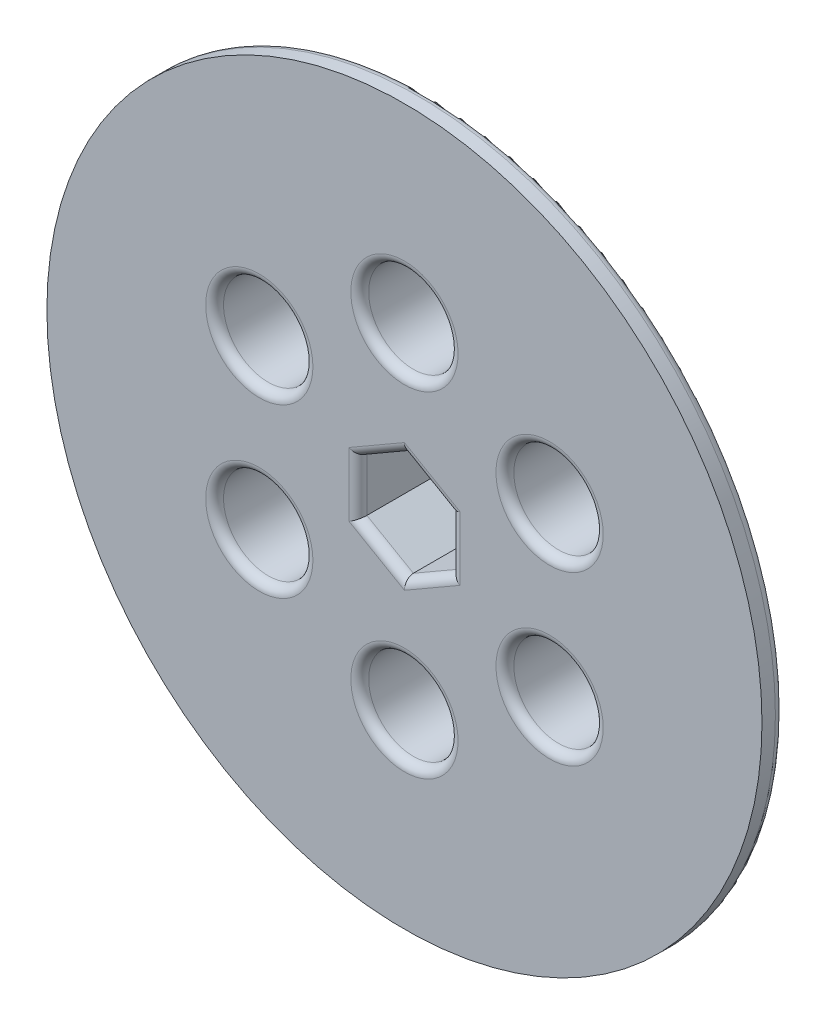
from build123d import *

# Parameters (mm, degrees)
SKETCH1_R           = 31.75
BOSS_EXTRUDE1_DEPTH = 12.7
SKETCH2_R           = 50.8
BOSS_EXTRUDE2_DEPTH = 3.175
CUT_EXTRUDE_R_REACH = 75.575
SKETCH3_R           = 2.667
SKETCH4_R           = 6.35
CUT_EXTRUDE2_DEPTH  = 10.16
FILLET1_R           = 1.27


with BuildPart() as part:
    # Sketch1 → Boss-Extrude1 (new body)
    with BuildSketch(Plane.XY):
        Circle(SKETCH1_R)
    extrude(amount=BOSS_EXTRUDE1_DEPTH)

    # Sketch2 → Boss-Extrude2 (add)
    with BuildSketch(Plane.XY.offset(12.7)):
        Circle(SKETCH2_R)
    extrude(amount=BOSS_EXTRUDE2_DEPTH)

    # Sketch3 → Cut-Extrude r (cut, up to next)
    with BuildSketch(Plane(origin=(0, 0, 0), x_dir=(-1, 0, 0), z_dir=(0, 0, -1)), mode=Mode.PRIVATE) as cut_extrude_r_sk1:
        with Locations((0, 23.8125)):
            Circle(SKETCH3_R)
    cut_extrude_r_tool1 = extrude(cut_extrude_r_sk1.sketch, amount=-CUT_EXTRUDE_R_REACH, mode=Mode.PRIVATE) & part.part
    # Sketch3 → Cut-Extrude r (cut, up to next)
    with BuildSketch(Plane(origin=(0, 0, 0), x_dir=(-1, 0, 0), z_dir=(0, 0, -1)), mode=Mode.PRIVATE) as cut_extrude_r_sk2:
        with Locations((20.622229928, 11.90625)):
            Circle(SKETCH3_R)
    cut_extrude_r_tool2 = extrude(cut_extrude_r_sk2.sketch, amount=-CUT_EXTRUDE_R_REACH, mode=Mode.PRIVATE) & part.part
    # Sketch3 → Cut-Extrude r (cut, up to next)
    with BuildSketch(Plane(origin=(0, 0, 0), x_dir=(-1, 0, 0), z_dir=(0, 0, -1)), mode=Mode.PRIVATE) as cut_extrude_r_sk3:
        with Locations((20.622229928, -11.90625)):
            Circle(SKETCH3_R)
    cut_extrude_r_tool3 = extrude(cut_extrude_r_sk3.sketch, amount=-CUT_EXTRUDE_R_REACH, mode=Mode.PRIVATE) & part.part
    # Sketch3 → Cut-Extrude r (cut, up to next)
    with BuildSketch(Plane(origin=(0, 0, 0), x_dir=(-1, 0, 0), z_dir=(0, 0, -1)), mode=Mode.PRIVATE) as cut_extrude_r_sk4:
        with Locations((0, -23.8125)):
            Circle(SKETCH3_R)
    cut_extrude_r_tool4 = extrude(cut_extrude_r_sk4.sketch, amount=-CUT_EXTRUDE_R_REACH, mode=Mode.PRIVATE) & part.part
    # Sketch3 → Cut-Extrude r (cut, up to next)
    with BuildSketch(Plane(origin=(0, 0, 0), x_dir=(-1, 0, 0), z_dir=(0, 0, -1)), mode=Mode.PRIVATE) as cut_extrude_r_sk5:
        with Locations((-20.622229928, -11.90625)):
            Circle(SKETCH3_R)
    cut_extrude_r_tool5 = extrude(cut_extrude_r_sk5.sketch, amount=-CUT_EXTRUDE_R_REACH, mode=Mode.PRIVATE) & part.part
    # Sketch3 → Cut-Extrude r (cut, up to next)
    with BuildSketch(Plane(origin=(0, 0, 0), x_dir=(-1, 0, 0), z_dir=(0, 0, -1)), mode=Mode.PRIVATE) as cut_extrude_r_sk6:
        with Locations((-20.622229928, 11.90625)):
            Circle(SKETCH3_R)
    cut_extrude_r_tool6 = extrude(cut_extrude_r_sk6.sketch, amount=-CUT_EXTRUDE_R_REACH, mode=Mode.PRIVATE) & part.part
    # Sketch3 → Cut-Extrude r (cut, up to next)
    with BuildSketch(Plane(origin=(0, 0, 0), x_dir=(-1, 0, 0), z_dir=(0, 0, -1)), mode=Mode.PRIVATE) as cut_extrude_r_sk7:
        Polygon((0, 7.625642355), (-6.604, 3.812821178), (-6.604, -3.812821178), (0, -7.625642355), (6.604, -3.812821178), (6.604, 3.812821178), align=None)
    cut_extrude_r_tool7 = extrude(cut_extrude_r_sk7.sketch, amount=-CUT_EXTRUDE_R_REACH, mode=Mode.PRIVATE) & part.part
    add(cut_extrude_r_tool1.solids().sort_by_distance((0, 23.8125, 0))[0], mode=Mode.SUBTRACT)
    add(cut_extrude_r_tool2.solids().sort_by_distance((-20.62223, 11.90625, 0))[0], mode=Mode.SUBTRACT)
    add(cut_extrude_r_tool3.solids().sort_by_distance((-20.62223, -11.90625, 0))[0], mode=Mode.SUBTRACT)
    add(cut_extrude_r_tool4.solids().sort_by_distance((0, -23.8125, 0))[0], mode=Mode.SUBTRACT)
    add(cut_extrude_r_tool5.solids().sort_by_distance((20.62223, -11.90625, 0))[0], mode=Mode.SUBTRACT)
    add(cut_extrude_r_tool6.solids().sort_by_distance((20.62223, 11.90625, 0))[0], mode=Mode.SUBTRACT)
    add(cut_extrude_r_tool7.solids().sort_by_distance((0, 0, 0))[0], mode=Mode.SUBTRACT)

    # Sketch4 → Cut-Extrude2 (cut)
    with BuildSketch(Plane.XY.offset(15.875)):
        with Locations((-20.622229928, -11.90625)):
            Circle(SKETCH4_R)
        with Locations((-20.622229928, 11.90625)):
            Circle(SKETCH4_R)
        with Locations((0, 23.8125)):
            Circle(SKETCH4_R)
        with Locations((20.622229928, 11.90625)):
            Circle(SKETCH4_R)
        with Locations((20.622229928, -11.90625)):
            Circle(SKETCH4_R)
        with Locations((0, -23.8125)):
            Circle(SKETCH4_R)
    extrude(amount=-CUT_EXTRUDE2_DEPTH, mode=Mode.SUBTRACT)

    # Fillet1
    fillet1_edges = [part.edges().sort_by_distance(p)[0] for p in [
        (-50.8, 0, 12.7),
        (-26.972229928, 11.90625, 15.875),
        (-6.35, 23.8125, 15.875),
        (14.272229928, 11.90625, 15.875),
        (14.272229928, -11.90625, 15.875),
        (-26.972229928, -11.90625, 15.875),
        (-6.35, -23.8125, 15.875),
        (6.604, 0, 15.875),
        (3.302, 5.719231767, 15.875),
        (-3.302, 5.719231767, 15.875),
        (-6.604, 0, 15.875),
        (-3.302, -5.719231767, 15.875),
        (3.302, -5.719231767, 15.875),
    ]]
    fillet(fillet1_edges, radius=FILLET1_R)


solid = part.part
